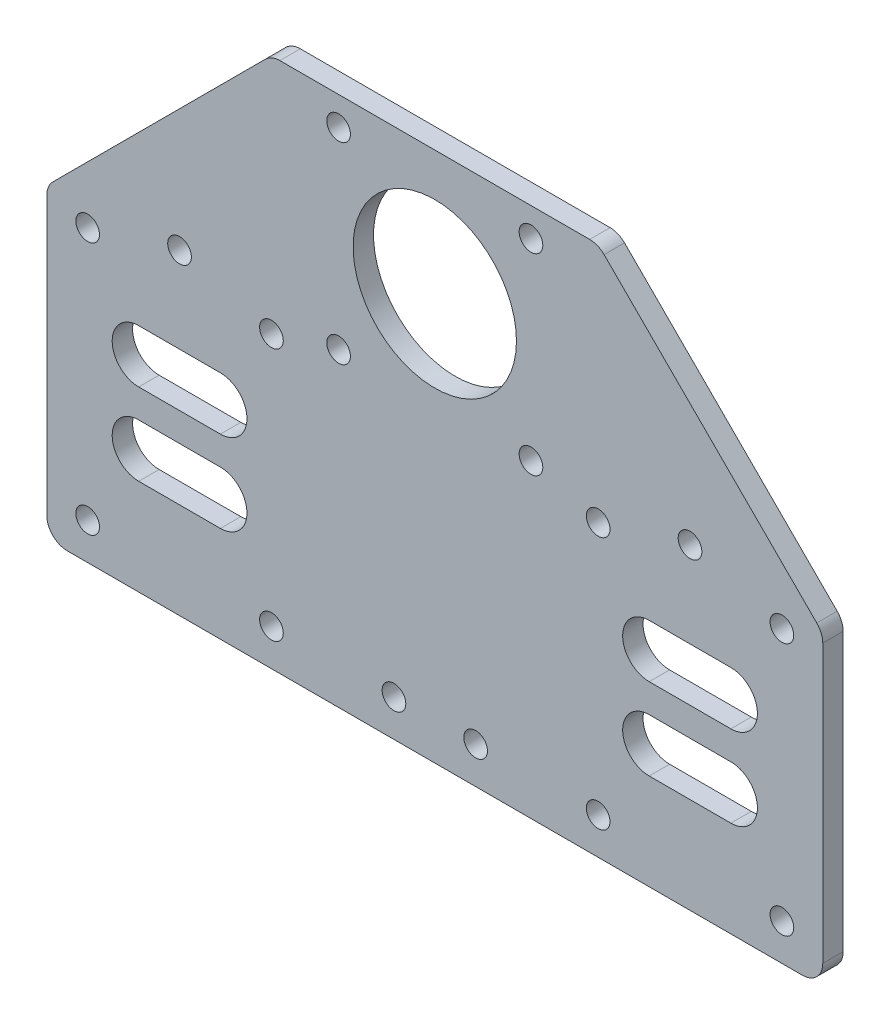
from build123d import *

# Parameters (mm, degrees)
SKETCH1_W                      = 190
SKETCH1_H                      = 130
BOSS_EXTRUDE1_DEPTH            = 5
M5_CLEARANCE_HOLE1_D           = 5.8
SKETCH6_R                      = 20
CUT_EXTRUDE1_DEPTH             = 10
F_13_0_13_DIAMETER_SLOT1_DEPTH = 5
CUT_EXTRUDE2_REACH             = 117.217
FILLET1_R                      = 5
M5_CLEARANCE_HOLE2_D           = 5.8


# Read off the part's stored shape, not the designer's step: Ø13.0 (13) Diameter Slot1
with BuildPart() as part:
    # Sketch1 → Boss-Extrude1 (new body)
    with BuildSketch(Plane.XY):
        Rectangle(SKETCH1_W, SKETCH1_H)
    extrude(amount=BOSS_EXTRUDE1_DEPTH)

    # M5 Clearance Hole1 (through all)
    with Locations(Plane.XY.offset(5)):
        with Locations((-40, 6), (40, 6), (-40, -56), (40, -56), (-23.55, 58), (23.55, 58), (-23.55, 10.9), (23.55, 10.9), (-10, -56), (10, -56), (-85, 6), (85, 6), (-85, -56), (85, -56)):
            Hole(M5_CLEARANCE_HOLE1_D / 2)

    # Sketch6 → Cut-Extrude1 (cut)
    with BuildSketch(Plane.XY.offset(5)):
        with Locations((0, 34.5)):
            Circle(SKETCH6_R)
    extrude(amount=-CUT_EXTRUDE1_DEPTH, mode=Mode.SUBTRACT)

    # Ø13.0 (13) Diameter Slot1 outline → Ø13.0 (13) Diameter Slot1 (cut)
    with BuildSketch(Plane.XY):
        with BuildLine():
            ThreePointArc((-52.5, -41.5), (-46, -35), (-52.5, -28.5))
            Line((-52.5, -28.5), (-72.5, -28.5))
            ThreePointArc((-72.5, -28.5), (-79, -35), (-72.5, -41.5))
            Line((-72.5, -41.5), (-52.5, -41.5))
        make_face()
        with BuildLine():
            ThreePointArc((52.5, -28.5), (46, -35), (52.5, -41.5))
            Line((52.5, -41.5), (72.5, -41.5))
            ThreePointArc((72.5, -41.5), (79, -35), (72.5, -28.5))
            Line((72.5, -28.5), (52.5, -28.5))
        make_face()
        with BuildLine():
            ThreePointArc((-52.5, -21.5), (-46, -15), (-52.5, -8.5))
            Line((-52.5, -8.5), (-72.5, -8.5))
            ThreePointArc((-72.5, -8.5), (-79, -15), (-72.5, -21.5))
            Line((-72.5, -21.5), (-52.5, -21.5))
        make_face()
        with BuildLine():
            ThreePointArc((52.5, -8.5), (46, -15), (52.5, -21.5))
            Line((52.5, -21.5), (72.5, -21.5))
            ThreePointArc((72.5, -21.5), (79, -15), (72.5, -8.5))
            Line((72.5, -8.5), (52.5, -8.5))
        make_face()
    extrude(amount=F_13_0_13_DIAMETER_SLOT1_DEPTH, mode=Mode.SUBTRACT)

    # Sketch14 → Cut-Extrude2 (cut, up to next)
    with BuildSketch(Plane(origin=(0, 0, 0), x_dir=(-1, 0, 0), z_dir=(0, 0, -1)), mode=Mode.PRIVATE) as cut_extrude2_sk1:
        Polygon((-40, 65), (-95, 10), (-95, 65), align=None)
    cut_extrude2_tool1 = extrude(cut_extrude2_sk1.sketch, amount=-CUT_EXTRUDE2_REACH, mode=Mode.PRIVATE) & part.part
    # Sketch14 → Cut-Extrude2 (cut, up to next)
    with BuildSketch(Plane(origin=(0, 0, 0), x_dir=(-1, 0, 0), z_dir=(0, 0, -1)), mode=Mode.PRIVATE) as cut_extrude2_sk2:
        Polygon((40, 65), (95, 10), (95, 65), align=None)
    cut_extrude2_tool2 = extrude(cut_extrude2_sk2.sketch, amount=-CUT_EXTRUDE2_REACH, mode=Mode.PRIVATE) & part.part
    add(cut_extrude2_tool1.solids().sort_by_distance((76.666667, 46.666667, 0))[0], mode=Mode.SUBTRACT)
    add(cut_extrude2_tool2.solids().sort_by_distance((-76.666667, 46.666667, 0))[0], mode=Mode.SUBTRACT)

    # Fillet1
    fillet1_edges = [part.edges().sort_by_distance(p)[0] for p in [
        (40, 65, 2.5),
        (95, 10, 2.5),
        (-40, 65, 2.5),
        (-95, 10, 2.5),
        (95, -65, 2.5),
        (-95, -65, 2.5),
    ]]
    fillet(fillet1_edges, radius=FILLET1_R)

    # M5 Clearance Hole2 (through all)
    with Locations(Plane.XY.offset(5)):
        with Locations((62.5, 12.5), (-62.5, 12.5)):
            Hole(M5_CLEARANCE_HOLE2_D / 2)


solid = part.part
